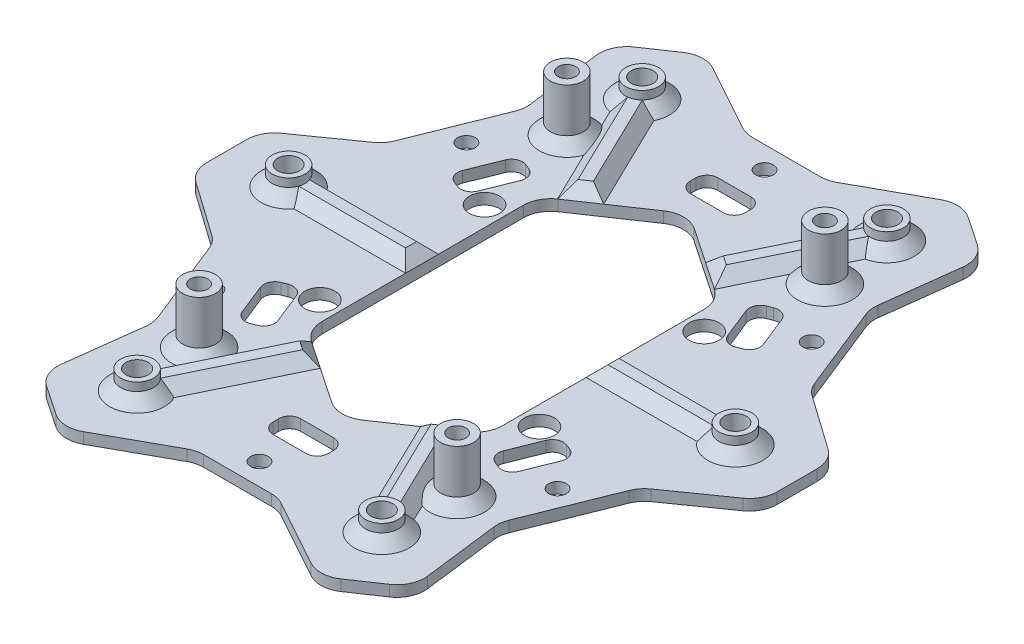
from build123d import *

# Parameters (mm, degrees)
BOSS_EXTRUDE1_DEPTH     = 2
BOSS_EXTRUDE2_DEPTH     = 2
MIRROR2_COPY_1_DEPTH    = 2
SKETCH2_R               = 3
SKETCH2_R_2             = 2
BOSS_EXTRUDE4_DEPTH     = 3.5
BOSS_EXTRUDE3_DEPTH     = 2
FILLET1_R               = 5
SKETCH13_R              = 1.6
CUT_EXTRUDE7_DEPTH      = 10
CUT_EXTRUDE8_DEPTH      = 78.908421133
CUT_EXTRUDE8_DEPTH_BACK = 78.908421133
SKETCH14_R              = 2
CHAMFER1_SIZE           = 2
SKETCH15_W              = 10
SKETCH15_H              = 5
CUT_EXTRUDE9_DEPTH      = 79.023855861
FILLET2_R               = 2
FILLET3_R               = 5
SKETCH16_R              = 3
SKETCH16_R_2            = 1.6
BOSS_EXTRUDE5_DEPTH     = 10
CUT_EXTRUDE10_START     = -10
SKETCH17_R              = 1.6
CUT_EXTRUDE10_DEPTH     = 10
CHAMFER2_SIZE           = 2
SKETCH18_W              = 20.216263692
SKETCH18_H              = 2
SKETCH18_W_2            = 20.016263692
BOSS_EXTRUDE6_DEPTH     = 2
CHAMFER3_SIZE           = 2
SKETCH19_R              = 2.75
CUT_EXTRUDE11_DEPTH     = 79.469561509


with BuildPart() as part:
    # Sketch1 → Boss-Extrude1 (new body)
    with BuildSketch(Plane(origin=(0, 0, 0), x_dir=(1, 0, 0), z_dir=(0, 1, 0))):
        Polygon((-25, 50), (25, 50), (45, 0), (25, -50), (-25, -50), (-45, 0), align=None)
    extrude(amount=BOSS_EXTRUDE1_DEPTH)

    # Sketch4 → Boss-Extrude2 (add)
    with BuildSketch(Plane(origin=(0, 2, 0), x_dir=(1, 0, 0), z_dir=(0, 1, 0))):
        Polygon((-33.774362449, 51.811826285), (-31.51705081, 33.707372975), (-25, 50), (-7.452303666, 50), (-23.423522069, 58.819686401), align=None)
    boss_extrude2 = extrude(amount=-BOSS_EXTRUDE2_DEPTH)

    # Mirror1: Boss-Extrude2 across plane
    add(boss_extrude2.mirror(Plane(origin=(0, 0, 0), x_dir=(0, 0, 1), z_dir=(1, 0, 0))))

    # Mirror2: Boss-Extrude2 across plane
    add(boss_extrude2.mirror(Plane.XY))

    # Mirror2 copy 1 sketch → Mirror2 copy 1 (add)
    with BuildSketch(Plane(origin=(0, 2, 0), x_dir=(-1, 0, 0), z_dir=(0, 1, 0))):
        Polygon((-33.774362449, 51.811826285), (-31.51705081, 33.707372975), (-25, 50), (-7.452303666, 50), (-23.423522069, 58.819686401), align=None)
    extrude(amount=-MIRROR2_COPY_1_DEPTH)

    # Sketch2 → Boss-Extrude4 (add)
    # profile 1 of 6: a face of its own
    with BuildSketch(Plane(origin=(0, 2, 0), x_dir=(1, 0, 0), z_dir=(0, 1, 0))):
        with Locations(Location((22.291868154, -46, 0), (0, 0, 90))):
            Circle(SKETCH2_R)
        with Locations(Location((22.291868154, -46, 0), (0, 0, 270))):
            Circle(SKETCH2_R_2, mode=Mode.SUBTRACT)
    # profile 2 of 6: a face of its own
    with BuildSketch(Plane(origin=(0, 2, 0), x_dir=(1, 0, 0), z_dir=(0, 1, 0))):
        with Locations(Location((-22.291868154, -46, 0), (0, 0, 90))):
            Circle(SKETCH2_R)
        with Locations(Location((-22.291868154, -46, 0), (0, 0, 270))):
            Circle(SKETCH2_R_2, mode=Mode.SUBTRACT)
    # profile 3 of 6: a face of its own
    with BuildSketch(Plane(origin=(0, 2, 0), x_dir=(1, 0, 0), z_dir=(0, 1, 0))):
        with Locations(Location((-40.691868154, 0, 0), (0, 0, 90))):
            Circle(SKETCH2_R)
        with Locations(Location((-40.691868154, 0, 0), (0, 0, 270))):
            Circle(SKETCH2_R_2, mode=Mode.SUBTRACT)
    # profile 4 of 6: a face of its own
    with BuildSketch(Plane(origin=(0, 2, 0), x_dir=(1, 0, 0), z_dir=(0, 1, 0))):
        with Locations(Location((40.691868154, 0, 0), (0, 0, 90))):
            Circle(SKETCH2_R)
        with Locations(Location((40.691868154, 0, 0), (0, 0, 270))):
            Circle(SKETCH2_R_2, mode=Mode.SUBTRACT)
    # profile 5 of 6: a face of its own
    with BuildSketch(Plane(origin=(0, 2, 0), x_dir=(1, 0, 0), z_dir=(0, 1, 0))):
        with Locations(Location((22.291868154, 46, 0), (0, 0, 90))):
            Circle(SKETCH2_R)
        with Locations(Location((22.291868154, 46, 0), (0, 0, 270))):
            Circle(SKETCH2_R_2, mode=Mode.SUBTRACT)
    # profile 6 of 6: a face of its own
    with BuildSketch(Plane(origin=(0, 2, 0), x_dir=(1, 0, 0), z_dir=(0, 1, 0))):
        with Locations(Location((-22.291868154, 46, 0), (0, 0, 90))):
            Circle(SKETCH2_R)
        with Locations(Location((-22.291868154, 46, 0), (0, 0, 270))):
            Circle(SKETCH2_R_2, mode=Mode.SUBTRACT)
    extrude(amount=BOSS_EXTRUDE4_DEPTH)

    # Sketch7 → Boss-Extrude3 (add)
    with BuildSketch(Plane(origin=(0, 2, 0), x_dir=(1, 0, 0), z_dir=(0, 1, 0))):
        Polygon((-38.786093236, -15.534766909), (-42.5, -6.25), (-45, 0), (-42.5, 6.25), (-38.786093236, 15.534766909), (-51.941868154, 6.25), (-51.941868154, -6.25), align=None)
    boss_extrude3 = extrude(amount=-BOSS_EXTRUDE3_DEPTH)

    # Mirror3: Boss-Extrude3 across plane
    add(boss_extrude3.mirror(Plane(origin=(0, 0, 0), x_dir=(0, 0, 1), z_dir=(1, 0, 0))))

    # Fillet1
    fillet1_edges = [part.edges().sort_by_distance(p)[0] for p in [
        (-51.941868154, 1, 6.25),
        (-38.786093236, 1, 15.534766909),
        (-38.786093236, 1, -15.534766909),
        (-51.941868154, 1, -6.25),
        (38.786093236, 1, 15.534766909),
        (51.941868154, 1, 6.25),
        (51.941868154, 1, -6.25),
        (38.786093236, 1, -15.534766909),
        (-31.51705081, 1, -33.707372975),
        (-7.452303666, 1, -50),
        (-23.423522069, 1, -58.819686401),
        (-33.774362449, 1, -51.811826285),
        (23.423522069, 1, -58.819686401),
        (33.774362449, 1, -51.811826285),
        (31.51705081, 1, -33.707372975),
        (7.452303666, 1, -50),
        (-23.423522069, 1, 58.819686401),
        (-33.774362449, 1, 51.811826285),
        (-31.51705081, 1, 33.707372975),
        (-7.452303666, 1, 50),
        (31.51705081, 1, 33.707372975),
        (7.452303666, 1, 50),
        (23.423522069, 1, 58.819686401),
        (33.774362449, 1, 51.811826285),
    ]]
    fillet(fillet1_edges, radius=FILLET1_R)

    # Sketch13 → Cut-Extrude7 (cut)
    with BuildSketch(Plane(origin=(0, 2, 0), x_dir=(1, 0, 0), z_dir=(0, 1, 0))):
        with Locations(Location((-31.43766526, 23.135507236, 0), (0, 0, 270))):
            Circle(SKETCH13_R)
        with Locations(Location((-31.43766526, -23.135507236, 0), (0, 0, 270))):
            Circle(SKETCH13_R)
        with Locations(Location((0, 46, 0), (0, 0, 270))):
            Circle(SKETCH13_R)
        with Locations(Location((31.43766526, 23.135507236, 0), (0, 0, 270))):
            Circle(SKETCH13_R)
        with Locations(Location((0, -46, 0), (0, 0, 270))):
            Circle(SKETCH13_R)
        with Locations(Location((31.43766526, -23.135507236, 0), (0, 0, 270))):
            Circle(SKETCH13_R)
    extrude(amount=-CUT_EXTRUDE7_DEPTH, mode=Mode.SUBTRACT)

    # Sketch14 → Cut-Extrude8 (cut, two sides: drawn at the far end of the back side and taken through both)
    with BuildSketch(Plane(origin=(0, 2, 0), x_dir=(1, 0, 0), z_dir=(0, 1, 0)).offset(-CUT_EXTRUDE8_DEPTH_BACK)):
        with Locations(Location((22.291868154, -46, 0), (0, 0, 270))):
            Circle(SKETCH14_R)
        with Locations(Location((-22.291868154, -46, 0), (0, 0, 270))):
            Circle(SKETCH14_R)
        with Locations(Location((-40.691868154, 0, 0), (0, 0, 270))):
            Circle(SKETCH14_R)
        with Locations(Location((40.691868154, 0, 0), (0, 0, 270))):
            Circle(SKETCH14_R)
        with Locations(Location((22.291868154, 46, 0), (0, 0, 270))):
            Circle(SKETCH14_R)
        with Locations(Location((-22.291868154, 46, 0), (0, 0, 270))):
            Circle(SKETCH14_R)
    extrude(amount=CUT_EXTRUDE8_DEPTH + CUT_EXTRUDE8_DEPTH_BACK, mode=Mode.SUBTRACT)

    # Chamfer1
    chamfer1_edges = [part.edges().sort_by_distance(p)[0] for p in [
        (22.291868154, 2, -43),
        (-22.291868154, 2, -43),
        (22.291868154, 2, 49),
        (-22.291868154, 2, 49),
        (-40.691868154, 2, 3),
        (40.691868154, 2, 3),
    ]]
    chamfer(chamfer1_edges, length=CHAMFER1_SIZE)

    # Sketch15 → Cut-Extrude9 (cut, through all)
    with BuildSketch(Plane.XZ):
        Polygon((16.491868154, -21.1024889), (16.491868154, 20.8524889), (0.05, 31.984175588), (-16.391868154, 20.8524889), (-16.391868154, -21.1024889), (0.05, -32.234175588), align=None)
        Polygon((23.510040742, -14.682453293), (28.152424196, -16.539406675), (24.438517433, -25.824173584), (19.796133978, -23.967220202), align=None)
        with Locations((0, -38)):
            Rectangle(SKETCH15_W, SKETCH15_H)
        with Locations((0, 38)):
            Rectangle(SKETCH15_W, SKETCH15_H)
        Polygon((-19.796133978, -23.967220202), (-24.438517433, -25.824173584), (-28.152424196, -16.539406675), (-23.510040742, -14.682453293), align=None)
        Polygon((-23.510040742, 14.682453293), (-28.152424196, 16.539406675), (-24.438517433, 25.824173584), (-19.796133978, 23.967220202), align=None)
        Polygon((19.796133978, 23.967220202), (24.438517433, 25.824173584), (28.152424196, 16.539406675), (23.510040742, 14.682453293), align=None)
    extrude(amount=-CUT_EXTRUDE9_DEPTH, mode=Mode.SUBTRACT)

    # Fillet2
    fillet2_edges = [part.edges().sort_by_distance(p)[0] for p in [
        (-23.510040742, 1, -14.682453293),
        (-19.796133978, 1, -23.967220202),
        (-24.438517433, 1, -25.824173584),
        (-28.152424196, 1, -16.539406675),
        (19.796133978, 1, -23.967220202),
        (23.510040742, 1, -14.682453293),
        (28.152424196, 1, -16.539406675),
        (24.438517433, 1, -25.824173584),
        (-5, 1, -40.5),
        (-5, 1, -35.5),
        (5, 1, -35.5),
        (5, 1, -40.5),
        (-5, 1, 35.5),
        (-5, 1, 40.5),
        (5, 1, 40.5),
        (5, 1, 35.5),
        (-19.796133978, 1, 23.967220202),
        (-23.510040742, 1, 14.682453293),
        (-28.152424196, 1, 16.539406675),
        (-24.438517433, 1, 25.824173584),
        (23.510040742, 1, 14.682453293),
        (19.796133978, 1, 23.967220202),
        (24.438517433, 1, 25.824173584),
        (28.152424196, 1, 16.539406675),
    ]]
    fillet(fillet2_edges, radius=FILLET2_R)

    # Fillet3
    fillet3_edges = [part.edges().sort_by_distance(p)[0] for p in [
        (16.491868154, 1, -21.1024889),
        (0.05, 1, -32.234175588),
        (-16.391868154, 1, -21.1024889),
        (-16.391868154, 1, 20.8524889),
        (0.05, 1, 31.984175588),
        (16.491868154, 1, 20.8524889),
    ]]
    fillet(fillet3_edges, radius=FILLET3_R)

    # Sketch16 → Boss-Extrude5 (add)
    # profile 1 of 4: a face of its own
    with BuildSketch(Plane(origin=(0, 2, 0), x_dir=(1, 0, 0), z_dir=(0, 1, 0))):
        with Locations(Location((-23.5, -33.5, 0), (0, 0, 90))):
            Circle(SKETCH16_R)
        with Locations(Location((-23.5, -33.5, 0), (0, 0, 270))):
            Circle(SKETCH16_R_2, mode=Mode.SUBTRACT)
    # profile 2 of 4: a face of its own
    with BuildSketch(Plane(origin=(0, 2, 0), x_dir=(1, 0, 0), z_dir=(0, 1, 0))):
        with Locations(Location((-23.5, 33.5, 0), (0, 0, 90))):
            Circle(SKETCH16_R)
        with Locations(Location((-23.5, 33.5, 0), (0, 0, 270))):
            Circle(SKETCH16_R_2, mode=Mode.SUBTRACT)
    # profile 3 of 4: a face of its own
    with BuildSketch(Plane(origin=(0, 2, 0), x_dir=(1, 0, 0), z_dir=(0, 1, 0))):
        with Locations(Location((23.5, 33.5, 0), (0, 0, 90))):
            Circle(SKETCH16_R)
        with Locations(Location((23.5, 33.5, 0), (0, 0, 270))):
            Circle(SKETCH16_R_2, mode=Mode.SUBTRACT)
    # profile 4 of 4: a face of its own
    with BuildSketch(Plane(origin=(0, 2, 0), x_dir=(1, 0, 0), z_dir=(0, 1, 0))):
        with Locations(Location((23.5, -33.5, 0), (0, 0, 90))):
            Circle(SKETCH16_R)
        with Locations(Location((23.5, -33.5, 0), (0, 0, 270))):
            Circle(SKETCH16_R_2, mode=Mode.SUBTRACT)
    extrude(amount=BOSS_EXTRUDE5_DEPTH)

    # Sketch17 → Cut-Extrude10 (cut)
    with BuildSketch(Plane(origin=(0, 2, 0), x_dir=(1, 0, 0), z_dir=(0, 1, 0)).offset(CUT_EXTRUDE10_START)):
        with Locations(Location((-23.5, -33.5, 0), (0, 0, 90))):
            Circle(SKETCH17_R)
        with Locations(Location((-23.5, 33.5, 0), (0, 0, 90))):
            Circle(SKETCH17_R)
        with Locations(Location((23.5, 33.5, 0), (0, 0, 90))):
            Circle(SKETCH17_R)
        with Locations(Location((23.5, -33.5, 0), (0, 0, 90))):
            Circle(SKETCH17_R)
    extrude(amount=CUT_EXTRUDE10_DEPTH, mode=Mode.SUBTRACT)

    # Chamfer2
    chamfer2_edges = [part.edges().sort_by_distance(p)[0] for p in [
        (-23.5, 2, 36.5),
        (-23.5, 2, -30.5),
        (23.5, 2, -30.5),
        (23.5, 2, 36.5),
    ]]
    chamfer(chamfer2_edges, length=CHAMFER2_SIZE)

    # Sketch18 → Boss-Extrude6 (add)
    with BuildSketch(Plane(origin=(0, 2, 0), x_dir=(1, 0, 0), z_dir=(0, 1, 0))):
        Polygon((22.159613697, -43.434019165), (14.091824838, -26.785872633), (13.401014009, -25.360361863), (11.727586205, -26.493327645), (12.292025213, -27.658066024), (20.359814072, -44.306212555), align=None)
        with Locations((-28.5, 0)):
            Rectangle(SKETCH18_W, SKETCH18_H)
        with Locations((28.5, 0)):
            Rectangle(SKETCH18_W_2, SKETCH18_H)
        Polygon((-22.159613697, -43.434019165), (-14.091824838, -26.785872633), (-13.376309877, -25.309384078), (-11.702882073, -26.44234986), (-12.292025213, -27.658066024), (-20.359814072, -44.306212555), align=None)
        Polygon((-20.519774952, 44.63629707), (-11.794104115, 26.630589531), (-13.467531919, 25.497623749), (-22.319574577, 43.76410368), align=None)
        Polygon((22.13034796, 43.37362836), (14.121090574, 26.846263439), (13.492236051, 25.548601534), (11.818808247, 26.681567316), (12.321290949, 27.718456829), (20.330548335, 44.24582175), align=None)
    extrude(amount=BOSS_EXTRUDE6_DEPTH)

    # Chamfer3
    # the kernel refuses this chamfer: 2 mm, written as the material it adds along each edge
    with BuildSketch(Plane(origin=(23.298344108, 2, 45.783826662), x_dir=(0.8998998125128265, 0, -0.4360966950567039), z_dir=(-0.43609669505670384, 0, -0.8998998125128265))) as chamfer3_piece_1_section:
        Polygon((CHAMFER3_SIZE, 0), (0, -CHAMFER3_SIZE), (0, 0), align=None)
    chamfer3_piece_1 = extrude(amount=27.838631065, mode=Mode.PRIVATE)
    chamfer3_piece_1 = chamfer3_piece_1 - Plane(origin=(22.291868154, 2, 46), x_dir=(0, 0, -1), z_dir=(0, -1, 0)) * Cylinder(3, 64, mode=Mode.PRIVATE)
    chamfer3_piece_1 = split(chamfer3_piece_1, bisect_by=Plane(origin=(10.706211611, 2, 27.18483191), z_dir=(0.5606288093051826, 0, 0.8280672304692738)), keep=Keep.TOP, mode=Mode.PRIVATE)
    add(chamfer3_piece_1)
    with BuildSketch(Plane(origin=(9.484581301, 2, 21.864813567), x_dir=(-0.8998998125128264, 0, 0.436096695056704), z_dir=(0.43609669505670406, 0, 0.8998998125128265))) as chamfer3_piece_2_section:
        Polygon((CHAMFER3_SIZE, 0), (0, -CHAMFER3_SIZE), (0, 0), align=None)
    chamfer3_piece_2 = extrude(amount=27.548851705, mode=Mode.PRIVATE)
    chamfer3_piece_2 = chamfer3_piece_2 - Plane(origin=(22.291868154, 2, 46), x_dir=(0, 0, -1), z_dir=(0, -1, 0)) * Cylinder(3, 64, mode=Mode.PRIVATE)
    chamfer3_piece_2 = split(chamfer3_piece_2, bisect_by=Plane(origin=(12.338301916, 2, 26.079852978), z_dir=(0.5606288093051826, 0, 0.8280672304692738)), keep=Keep.TOP, mode=Mode.PRIVATE)
    add(chamfer3_piece_2)
    with BuildSketch(Plane(origin=(-11.224527015, 2, -20.869109672), x_dir=(-0.8998998125128265, 0, 0.43609669505670395), z_dir=(-0.436096695056704, 0, -0.8998998125128265))) as chamfer3_piece_3_section:
        Polygon((CHAMFER3_SIZE, 0), (0, CHAMFER3_SIZE), (0, 0), align=None)
    chamfer3_piece_3 = extrude(amount=27.686100879, mode=Mode.PRIVATE)
    chamfer3_piece_3 = chamfer3_piece_3 - Plane(origin=(-22.291868154, 2, -46), x_dir=(0, 0, -1), z_dir=(0, -1, 0)) * Cylinder(3, 64, mode=Mode.PRIVATE)
    chamfer3_piece_3 = split(chamfer3_piece_3, bisect_by=Plane(origin=(-14.07824763, 2, -25.084149083), z_dir=(-0.5606288093051838, 0, -0.828067230469273)), keep=Keep.TOP, mode=Mode.PRIVATE)
    add(chamfer3_piece_3)
    with BuildSketch(Plane(origin=(-21.498544483, 2, -46.656020052), x_dir=(0.8998998125128265, 0, -0.4360966950567039), z_dir=(0.43609669505670395, 0, 0.8998998125128265))) as chamfer3_piece_4_section:
        Polygon((CHAMFER3_SIZE, 0), (0, CHAMFER3_SIZE), (0, 0), align=None)
    chamfer3_piece_4 = extrude(amount=27.396321519, mode=Mode.PRIVATE)
    chamfer3_piece_4 = chamfer3_piece_4 - Plane(origin=(-22.291868154, 2, -46), x_dir=(0, 0, -1), z_dir=(0, -1, 0)) * Cylinder(3, 63, mode=Mode.PRIVATE)
    chamfer3_piece_4 = split(chamfer3_piece_4, bisect_by=Plane(origin=(-9.151820903, 2, -28.419502359), z_dir=(-0.5606288093051838, 0, -0.828067230469273)), keep=Keep.TOP, mode=Mode.PRIVATE)
    add(chamfer3_piece_4)
    with BuildSketch(Plane(origin=(-7.535051296, 2, -29.514108674), x_dir=(0.5606288093051838, 0, 0.8280672304692729), z_dir=(-0.828067230469273, 0, 0.5606288093051838))) as chamfer3_piece_5_section:
        Polygon((CHAMFER3_SIZE, 0), (0, CHAMFER3_SIZE), (0, 0), align=None)
    chamfer3_piece_5 = extrude(amount=12.307615936, mode=Mode.PRIVATE)
    chamfer3_piece_5 = split(chamfer3_piece_5, bisect_by=Plane(origin=(-13.915533547, 2, -26.42208978), z_dir=(0.8998998125128265, 0, -0.436096695056704)), keep=Keep.TOP, mode=Mode.PRIVATE)
    chamfer3_piece_5 = split(chamfer3_piece_5, bisect_by=Plane(origin=(-12.115733922, 2, -27.294283171), z_dir=(-0.8998998125128265, 0, 0.43609669505670395)), keep=Keep.TOP, mode=Mode.PRIVATE)
    add(chamfer3_piece_5)
    with BuildSketch(Plane(origin=(21.498544483, 2, -46.656020052), x_dir=(-0.899899812512827, 0, -0.4360966950567028), z_dir=(-0.43609669505670273, 0, 0.899899812512827))) as chamfer3_piece_6_section:
        Polygon((CHAMFER3_SIZE, 0), (0, -CHAMFER3_SIZE), (0, 0), align=None)
    chamfer3_piece_6 = extrude(amount=27.33967323, mode=Mode.PRIVATE)
    chamfer3_piece_6 = chamfer3_piece_6 - Plane(origin=(22.291868154, 2, -46), x_dir=(0, 0, -1), z_dir=(0, -1, 0)) * Cylinder(3, 63, mode=Mode.PRIVATE)
    chamfer3_piece_6 = split(chamfer3_piece_6, bisect_by=Plane(origin=(9.183251369, 2, -28.465926194), z_dir=(0.5606288093051821, 0, -0.828067230469274)), keep=Keep.TOP, mode=Mode.PRIVATE)
    add(chamfer3_piece_6)
    with BuildSketch(Plane(origin=(11.249231147, 2, -20.920087456), x_dir=(0.8998998125128266, 0, 0.4360966950567037), z_dir=(0.4360966950567037, 0, -0.8998998125128266))) as chamfer3_piece_7_section:
        Polygon((CHAMFER3_SIZE, 0), (0, -CHAMFER3_SIZE), (0, 0), align=None)
    chamfer3_piece_7 = extrude(amount=27.62945259, mode=Mode.PRIVATE)
    chamfer3_piece_7 = chamfer3_piece_7 - Plane(origin=(22.291868154, 2, -46), x_dir=(0, 0, -1), z_dir=(0, -1, 0)) * Cylinder(3, 64, mode=Mode.PRIVATE)
    chamfer3_piece_7 = split(chamfer3_piece_7, bisect_by=Plane(origin=(14.102951762, 2, -25.135126867), z_dir=(0.5606288093051821, 0, -0.828067230469274)), keep=Keep.TOP, mode=Mode.PRIVATE)
    add(chamfer3_piece_7)
    with BuildSketch(Plane(origin=(40.936254645, 2, -1), x_dir=(0, 0, -1), z_dir=(-1, 0, 0))) as chamfer3_piece_8_section:
        Polygon((CHAMFER3_SIZE, 0), (0, -CHAMFER3_SIZE), (0, 0), align=None)
    chamfer3_piece_8 = extrude(amount=22.44438649, mode=Mode.PRIVATE)
    chamfer3_piece_8 = chamfer3_piece_8 - Plane(origin=(40.691868154, 2, 0), x_dir=(0, 0, -1), z_dir=(0, -1, 0)) * Cylinder(3, 53, mode=Mode.PRIVATE)
    add(chamfer3_piece_8)
    with BuildSketch(Plane(origin=(18.491868154, 2, -1), x_dir=(-1, 0, 0), z_dir=(0, 0, 1)), Plane(origin=(-18.391868154, 2, 1), x_dir=(1, 0, 0), z_dir=(0, 0, -1))) as chamfer3_piece_9:
        Polygon((CHAMFER3_SIZE, 0), (0, -CHAMFER3_SIZE), (0, 0), align=None)
    extrude(amount=2)
    with BuildSketch(Plane(origin=(18.491868154, 2, 1), x_dir=(0, 0, 1), z_dir=(1, 0, 0))) as chamfer3_piece_10_section:
        Polygon((CHAMFER3_SIZE, 0), (0, -CHAMFER3_SIZE), (0, 0), align=None)
    chamfer3_piece_10 = extrude(amount=22.44438649, mode=Mode.PRIVATE)
    chamfer3_piece_10 = chamfer3_piece_10 - Plane(origin=(40.691868154, 2, 0), x_dir=(0, 0, -1), z_dir=(0, -1, 0)) * Cylinder(3, 53, mode=Mode.PRIVATE)
    add(chamfer3_piece_10)
    with BuildSketch(Plane(origin=(-40.936254645, 2, 1), x_dir=(0, 0, 1), z_dir=(1, 0, 0))) as chamfer3_piece_11_section:
        Polygon((CHAMFER3_SIZE, 0), (0, -CHAMFER3_SIZE), (0, 0), align=None)
    chamfer3_piece_11 = extrude(amount=22.54438649, mode=Mode.PRIVATE)
    chamfer3_piece_11 = chamfer3_piece_11 - Plane(origin=(-40.691868154, 2, 0), x_dir=(0, 0, -1), z_dir=(0, -1, 0)) * Cylinder(3, 54, mode=Mode.PRIVATE)
    add(chamfer3_piece_11)
    with BuildSketch(Plane(origin=(-18.391868154, 2, -1), x_dir=(0, 0, -1), z_dir=(-1, 0, 0))) as chamfer3_piece_12_section:
        Polygon((CHAMFER3_SIZE, 0), (0, -CHAMFER3_SIZE), (0, 0), align=None)
    chamfer3_piece_12 = extrude(amount=22.54438649, mode=Mode.PRIVATE)
    chamfer3_piece_12 = chamfer3_piece_12 - Plane(origin=(-40.691868154, 2, 0), x_dir=(0, 0, -1), z_dir=(0, -1, 0)) * Cylinder(3, 54, mode=Mode.PRIVATE)
    add(chamfer3_piece_12)
    with BuildSketch(Plane(origin=(-21.498544483, 2, 46.656020052), x_dir=(0.8998998125128265, 0, 0.43609669505670384), z_dir=(0.43609669505670384, 0, -0.8998998125128266))) as chamfer3_piece_13_section:
        Polygon((CHAMFER3_SIZE, 0), (0, -CHAMFER3_SIZE), (0, 0), align=None)
    chamfer3_piece_13 = extrude(amount=27.605499994, mode=Mode.PRIVATE)
    chamfer3_piece_13 = chamfer3_piece_13 - Plane(origin=(-22.291868154, 2, 46), x_dir=(0, 0, -1), z_dir=(0, -1, 0)) * Cylinder(3, 64, mode=Mode.PRIVATE)
    chamfer3_piece_13 = split(chamfer3_piece_13, bisect_by=Plane(origin=(-9.035761316, 2, 28.248078524), z_dir=(-0.5606288093051821, 0, 0.828067230469274)), keep=Keep.TOP, mode=Mode.PRIVATE)
    add(chamfer3_piece_13)
    with BuildSketch(Plane(origin=(-11.133304973, 2, 20.680870001), x_dir=(-0.8998998125128266, 0, -0.4360966950567037), z_dir=(-0.4360966950567037, 0, 0.8998998125128266))) as chamfer3_piece_14_section:
        Polygon((CHAMFER3_SIZE, 0), (0, -CHAMFER3_SIZE), (0, 0), align=None)
    chamfer3_piece_14 = extrude(amount=27.895279354, mode=Mode.PRIVATE)
    chamfer3_piece_14 = chamfer3_piece_14 - Plane(origin=(-22.291868154, 2, 46), x_dir=(0, 0, -1), z_dir=(0, -1, 0)) * Cylinder(3, 64, mode=Mode.PRIVATE)
    chamfer3_piece_14 = split(chamfer3_piece_14, bisect_by=Plane(origin=(-13.987025588, 2, 24.895909412), z_dir=(-0.5606288093051821, 0, 0.828067230469274)), keep=Keep.TOP, mode=Mode.PRIVATE)
    add(chamfer3_piece_14)
    with BuildSketch(Plane(origin=(17.75128887, 2, -22.665082391), x_dir=(-0.5606288093051821, 0, 0.828067230469274), z_dir=(-0.828067230469274, 0, -0.5606288093051821))) as chamfer3_piece_15_section:
        Polygon((CHAMFER3_SIZE, 0), (0, CHAMFER3_SIZE), (0, 0), align=None)
    chamfer3_piece_15 = extrude(amount=12.307615936, mode=Mode.PRIVATE)
    chamfer3_piece_15 = split(chamfer3_piece_15, bisect_by=Plane(origin=(11.370806619, 2, -25.757101284), z_dir=(0.8998998125128278, 0, 0.43609669505670123)), keep=Keep.TOP, mode=Mode.PRIVATE)
    chamfer3_piece_15 = split(chamfer3_piece_15, bisect_by=Plane(origin=(13.170606244, 2, -24.884907894), z_dir=(-0.8998998125128269, 0, -0.4360966950567029)), keep=Keep.TOP, mode=Mode.PRIVATE)
    add(chamfer3_piece_15)
    with BuildSketch(Plane(origin=(17.660066828, 2, 22.47684272), x_dir=(-0.5606288093051826, 0, -0.8280672304692737), z_dir=(-0.8280672304692738, 0, 0.5606288093051826))) as chamfer3_piece_16_section:
        Polygon((CHAMFER3_SIZE, 0), (0, -CHAMFER3_SIZE), (0, 0), align=None)
    chamfer3_piece_16 = extrude(amount=12.307615936, mode=Mode.PRIVATE)
    chamfer3_piece_16 = split(chamfer3_piece_16, bisect_by=Plane(origin=(13.079384202, 2, 24.696668223), z_dir=(-0.8998998125128287, 0, 0.43609669505669946)), keep=Keep.TOP, mode=Mode.PRIVATE)
    chamfer3_piece_16 = split(chamfer3_piece_16, bisect_by=Plane(origin=(11.279584577, 2, 25.568861613), z_dir=(0.8998998125127963, 0, -0.43609669505676624)), keep=Keep.TOP, mode=Mode.PRIVATE)
    add(chamfer3_piece_16)
    with BuildSketch(Plane(origin=(-17.635362696, 2, 22.425864935), x_dir=(0.5606288093051821, 0, -0.828067230469274), z_dir=(0.828067230469274, 0, 0.5606288093051821))) as chamfer3_piece_17_section:
        Polygon((CHAMFER3_SIZE, 0), (0, CHAMFER3_SIZE), (0, 0), align=None)
    chamfer3_piece_17 = extrude(amount=12.307615936, mode=Mode.PRIVATE)
    chamfer3_piece_17 = split(chamfer3_piece_17, bisect_by=Plane(origin=(-11.254880445, 2, 25.517883829), z_dir=(-0.8998998125128264, 0, -0.4360966950567041)), keep=Keep.TOP, mode=Mode.PRIVATE)
    chamfer3_piece_17 = split(chamfer3_piece_17, bisect_by=Plane(origin=(-13.05468007, 2, 24.645690439), z_dir=(0.8998998125128266, 0, 0.4360966950567036)), keep=Keep.TOP, mode=Mode.PRIVATE)
    add(chamfer3_piece_17)
    with BuildSketch(Plane(origin=(23.298344108, 2, 45.783826662), x_dir=(0.8998998125128265, 0, -0.4360966950567039), z_dir=(-0.43609669505670384, 0, -0.8998998125128265))) as chamfer3_piece_18a_section:
        Polygon((CHAMFER3_SIZE, 0), (0, -CHAMFER3_SIZE), (0, 0), align=None)
    chamfer3_piece_18a = extrude(amount=27.838631065, mode=Mode.PRIVATE)
    chamfer3_piece_18a = split(chamfer3_piece_18a, bisect_by=Plane(origin=(9.584953993, 2, 25.52869745), z_dir=(0.5606288093051828, 0, 0.8280672304692737)), keep=Keep.TOP, mode=Mode.PRIVATE)
    chamfer3_piece_18a = split(chamfer3_piece_18a, bisect_by=Plane(origin=(10.706211611, 2, 27.18483191), z_dir=(-0.5606288093051826, 0, -0.8280672304692738)), keep=Keep.TOP, mode=Mode.PRIVATE)
    with BuildSketch(Plane(origin=(17.660066828, 2, 22.47684272), x_dir=(-0.5606288093051826, 0, -0.8280672304692737), z_dir=(-0.8280672304692738, 0, 0.5606288093051826))) as chamfer3_piece_18b_section:
        Polygon((CHAMFER3_SIZE, 0), (0, -CHAMFER3_SIZE), (0, 0), align=None)
    chamfer3_piece_18b = extrude(amount=12.307615936, mode=Mode.PRIVATE)
    chamfer3_piece_18b = split(chamfer3_piece_18b, bisect_by=Plane(origin=(13.079384202, 2, 24.696668223), z_dir=(0.8998998125128287, 0, -0.43609669505669946)), keep=Keep.TOP, mode=Mode.PRIVATE)
    chamfer3_piece_18 = chamfer3_piece_18a & chamfer3_piece_18b
    add(chamfer3_piece_18)
    with BuildSketch(Plane(origin=(9.484581301, 2, 21.864813567), x_dir=(-0.8998998125128264, 0, 0.436096695056704), z_dir=(0.43609669505670406, 0, 0.8998998125128265))) as chamfer3_piece_19a_section:
        Polygon((CHAMFER3_SIZE, 0), (0, -CHAMFER3_SIZE), (0, 0), align=None)
    chamfer3_piece_19a = extrude(amount=27.548851705, mode=Mode.PRIVATE)
    chamfer3_piece_19a = split(chamfer3_piece_19a, bisect_by=Plane(origin=(11.217044297, 2, 24.423718517), z_dir=(0.5606288093051828, 0, 0.8280672304692737)), keep=Keep.TOP, mode=Mode.PRIVATE)
    chamfer3_piece_19a = split(chamfer3_piece_19a, bisect_by=Plane(origin=(12.338301916, 2, 26.079852978), z_dir=(-0.5606288093051826, 0, -0.8280672304692738)), keep=Keep.TOP, mode=Mode.PRIVATE)
    with BuildSketch(Plane(origin=(17.660066828, 2, 22.47684272), x_dir=(-0.5606288093051826, 0, -0.8280672304692737), z_dir=(-0.8280672304692738, 0, 0.5606288093051826))) as chamfer3_piece_19b_section:
        Polygon((CHAMFER3_SIZE, 0), (0, -CHAMFER3_SIZE), (0, 0), align=None)
    chamfer3_piece_19b = extrude(amount=12.307615936, mode=Mode.PRIVATE)
    chamfer3_piece_19b = split(chamfer3_piece_19b, bisect_by=Plane(origin=(11.279584577, 2, 25.568861613), z_dir=(-0.8998998125127963, 0, 0.43609669505676624)), keep=Keep.TOP, mode=Mode.PRIVATE)
    chamfer3_piece_19 = chamfer3_piece_19a & chamfer3_piece_19b
    add(chamfer3_piece_19)
    with BuildSketch(Plane(origin=(-11.224527015, 2, -20.869109672), x_dir=(-0.8998998125128265, 0, 0.43609669505670395), z_dir=(-0.436096695056704, 0, -0.8998998125128265))) as chamfer3_piece_20a_section:
        Polygon((CHAMFER3_SIZE, 0), (0, CHAMFER3_SIZE), (0, 0), align=None)
    chamfer3_piece_20a = extrude(amount=27.686100879, mode=Mode.PRIVATE)
    chamfer3_piece_20a = split(chamfer3_piece_20a, bisect_by=Plane(origin=(-14.07824763, 2, -25.084149083), z_dir=(0.5606288093051838, 0, 0.828067230469273)), keep=Keep.TOP, mode=Mode.PRIVATE)
    chamfer3_piece_20a = split(chamfer3_piece_20a, bisect_by=Plane(origin=(-12.956990012, 2, -23.428014622), z_dir=(-0.5606288093051829, 0, -0.8280672304692736)), keep=Keep.TOP, mode=Mode.PRIVATE)
    with BuildSketch(Plane(origin=(-7.535051296, 2, -29.514108674), x_dir=(0.5606288093051838, 0, 0.8280672304692729), z_dir=(-0.828067230469273, 0, 0.5606288093051838))) as chamfer3_piece_20b_section:
        Polygon((CHAMFER3_SIZE, 0), (0, CHAMFER3_SIZE), (0, 0), align=None)
    chamfer3_piece_20b = extrude(amount=12.307615936, mode=Mode.PRIVATE)
    chamfer3_piece_20b = split(chamfer3_piece_20b, bisect_by=Plane(origin=(-13.915533547, 2, -26.42208978), z_dir=(-0.8998998125128265, 0, 0.436096695056704)), keep=Keep.TOP, mode=Mode.PRIVATE)
    chamfer3_piece_20 = chamfer3_piece_20a & chamfer3_piece_20b
    add(chamfer3_piece_20)
    with BuildSketch(Plane(origin=(-21.498544483, 2, -46.656020052), x_dir=(0.8998998125128265, 0, -0.4360966950567039), z_dir=(0.43609669505670395, 0, 0.8998998125128265))) as chamfer3_piece_21a_section:
        Polygon((CHAMFER3_SIZE, 0), (0, CHAMFER3_SIZE), (0, 0), align=None)
    chamfer3_piece_21a = extrude(amount=27.396321519, mode=Mode.PRIVATE)
    chamfer3_piece_21a = split(chamfer3_piece_21a, bisect_by=Plane(origin=(-9.151820903, 2, -28.419502359), z_dir=(0.5606288093051838, 0, 0.828067230469273)), keep=Keep.TOP, mode=Mode.PRIVATE)
    chamfer3_piece_21a = split(chamfer3_piece_21a, bisect_by=Plane(origin=(-8.030563284, 2, -26.763367898), z_dir=(-0.5606288093051829, 0, -0.8280672304692736)), keep=Keep.TOP, mode=Mode.PRIVATE)
    with BuildSketch(Plane(origin=(-7.535051296, 2, -29.514108674), x_dir=(0.5606288093051838, 0, 0.8280672304692729), z_dir=(-0.828067230469273, 0, 0.5606288093051838))) as chamfer3_piece_21b_section:
        Polygon((CHAMFER3_SIZE, 0), (0, CHAMFER3_SIZE), (0, 0), align=None)
    chamfer3_piece_21b = extrude(amount=12.307615936, mode=Mode.PRIVATE)
    chamfer3_piece_21b = split(chamfer3_piece_21b, bisect_by=Plane(origin=(-12.115733922, 2, -27.294283171), z_dir=(0.8998998125128265, 0, -0.43609669505670395)), keep=Keep.TOP, mode=Mode.PRIVATE)
    chamfer3_piece_21 = chamfer3_piece_21a & chamfer3_piece_21b
    add(chamfer3_piece_21)
    with BuildSketch(Plane(origin=(21.498544483, 2, -46.656020052), x_dir=(-0.899899812512827, 0, -0.4360966950567028), z_dir=(-0.43609669505670273, 0, 0.899899812512827))) as chamfer3_piece_22a_section:
        Polygon((CHAMFER3_SIZE, 0), (0, -CHAMFER3_SIZE), (0, 0), align=None)
    chamfer3_piece_22a = extrude(amount=27.33967323, mode=Mode.PRIVATE)
    chamfer3_piece_22a = split(chamfer3_piece_22a, bisect_by=Plane(origin=(9.183251369, 2, -28.465926194), z_dir=(-0.5606288093051821, 0, 0.828067230469274)), keep=Keep.TOP, mode=Mode.PRIVATE)
    chamfer3_piece_22a = split(chamfer3_piece_22a, bisect_by=Plane(origin=(8.06199375, 2, -26.809791733), z_dir=(0.5606288093051829, 0, -0.8280672304692736)), keep=Keep.TOP, mode=Mode.PRIVATE)
    with BuildSketch(Plane(origin=(17.75128887, 2, -22.665082391), x_dir=(-0.5606288093051821, 0, 0.828067230469274), z_dir=(-0.828067230469274, 0, -0.5606288093051821))) as chamfer3_piece_22b_section:
        Polygon((CHAMFER3_SIZE, 0), (0, CHAMFER3_SIZE), (0, 0), align=None)
    chamfer3_piece_22b = extrude(amount=12.307615936, mode=Mode.PRIVATE)
    chamfer3_piece_22b = split(chamfer3_piece_22b, bisect_by=Plane(origin=(11.370806619, 2, -25.757101284), z_dir=(-0.8998998125128278, 0, -0.43609669505670123)), keep=Keep.TOP, mode=Mode.PRIVATE)
    chamfer3_piece_22 = chamfer3_piece_22a & chamfer3_piece_22b
    add(chamfer3_piece_22)
    with BuildSketch(Plane(origin=(11.249231147, 2, -20.920087456), x_dir=(0.8998998125128266, 0, 0.4360966950567037), z_dir=(0.4360966950567037, 0, -0.8998998125128266))) as chamfer3_piece_23a_section:
        Polygon((CHAMFER3_SIZE, 0), (0, -CHAMFER3_SIZE), (0, 0), align=None)
    chamfer3_piece_23a = extrude(amount=27.62945259, mode=Mode.PRIVATE)
    chamfer3_piece_23a = split(chamfer3_piece_23a, bisect_by=Plane(origin=(14.102951762, 2, -25.135126867), z_dir=(-0.5606288093051821, 0, 0.828067230469274)), keep=Keep.TOP, mode=Mode.PRIVATE)
    chamfer3_piece_23a = split(chamfer3_piece_23a, bisect_by=Plane(origin=(12.981694143, 2, -23.478992406), z_dir=(0.5606288093051829, 0, -0.8280672304692736)), keep=Keep.TOP, mode=Mode.PRIVATE)
    with BuildSketch(Plane(origin=(17.75128887, 2, -22.665082391), x_dir=(-0.5606288093051821, 0, 0.828067230469274), z_dir=(-0.828067230469274, 0, -0.5606288093051821))) as chamfer3_piece_23b_section:
        Polygon((CHAMFER3_SIZE, 0), (0, CHAMFER3_SIZE), (0, 0), align=None)
    chamfer3_piece_23b = extrude(amount=12.307615936, mode=Mode.PRIVATE)
    chamfer3_piece_23b = split(chamfer3_piece_23b, bisect_by=Plane(origin=(13.170606244, 2, -24.884907894), z_dir=(0.8998998125128269, 0, 0.4360966950567029)), keep=Keep.TOP, mode=Mode.PRIVATE)
    chamfer3_piece_23 = chamfer3_piece_23a & chamfer3_piece_23b
    add(chamfer3_piece_23)
    with BuildSketch(Plane(origin=(40.936254645, 2, -1), x_dir=(0, 0, -1), z_dir=(-1, 0, 0))) as chamfer3_piece_24a_section:
        Polygon((CHAMFER3_SIZE, 0), (0, -CHAMFER3_SIZE), (0, 0), align=None)
    chamfer3_piece_24a = extrude(amount=27.587752466, mode=Mode.PRIVATE)
    chamfer3_piece_24a = split(chamfer3_piece_24a, bisect_by=Plane(origin=(16.491868154, 2, -1), z_dir=(1, 0, 0)), keep=Keep.TOP, mode=Mode.PRIVATE)
    chamfer3_piece_24a = split(chamfer3_piece_24a, bisect_by=Plane(origin=(18.491868154, 2, -1), z_dir=(-1, 0, 0)), keep=Keep.TOP, mode=Mode.PRIVATE)
    with BuildSketch(Plane(origin=(18.491868154, 2, -6.143365976), x_dir=(-1, 0, 0), z_dir=(0, 0, 1))) as chamfer3_piece_24b_section:
        Polygon((CHAMFER3_SIZE, 0), (0, -CHAMFER3_SIZE), (0, 0), align=None)
    chamfer3_piece_24b = extrude(amount=7.143365976, mode=Mode.PRIVATE)
    chamfer3_piece_24b = split(chamfer3_piece_24b, bisect_by=Plane(origin=(18.491868154, 2, -1), z_dir=(0, 0, -1)), keep=Keep.TOP, mode=Mode.PRIVATE)
    chamfer3_piece_24 = chamfer3_piece_24a & chamfer3_piece_24b
    add(chamfer3_piece_24)
    with BuildSketch(Plane(origin=(13.348502178, 2, 1), x_dir=(0, 0, 1), z_dir=(1, 0, 0))) as chamfer3_piece_25a_section:
        Polygon((CHAMFER3_SIZE, 0), (0, -CHAMFER3_SIZE), (0, 0), align=None)
    chamfer3_piece_25a = extrude(amount=27.587752466, mode=Mode.PRIVATE)
    chamfer3_piece_25a = split(chamfer3_piece_25a, bisect_by=Plane(origin=(16.491868154, 2, 1), z_dir=(1, 0, 0)), keep=Keep.TOP, mode=Mode.PRIVATE)
    chamfer3_piece_25a = split(chamfer3_piece_25a, bisect_by=Plane(origin=(18.491868154, 2, 1), z_dir=(-1, 0, 0)), keep=Keep.TOP, mode=Mode.PRIVATE)
    with BuildSketch(Plane(origin=(18.491868154, 2, -1), x_dir=(-1, 0, 0), z_dir=(0, 0, 1))) as chamfer3_piece_25b_section:
        Polygon((CHAMFER3_SIZE, 0), (0, -CHAMFER3_SIZE), (0, 0), align=None)
    chamfer3_piece_25b = extrude(amount=7.143365976, mode=Mode.PRIVATE)
    chamfer3_piece_25b = split(chamfer3_piece_25b, bisect_by=Plane(origin=(18.491868154, 2, 1), z_dir=(0, 0, 1)), keep=Keep.TOP, mode=Mode.PRIVATE)
    chamfer3_piece_25 = chamfer3_piece_25a & chamfer3_piece_25b
    add(chamfer3_piece_25)
    with BuildSketch(Plane(origin=(-40.936254645, 2, 1), x_dir=(0, 0, 1), z_dir=(1, 0, 0))) as chamfer3_piece_26a_section:
        Polygon((CHAMFER3_SIZE, 0), (0, -CHAMFER3_SIZE), (0, 0), align=None)
    chamfer3_piece_26a = extrude(amount=27.687752466, mode=Mode.PRIVATE)
    chamfer3_piece_26a = split(chamfer3_piece_26a, bisect_by=Plane(origin=(-16.391868154, 2, 1), z_dir=(-1, 0, 0)), keep=Keep.TOP, mode=Mode.PRIVATE)
    chamfer3_piece_26a = split(chamfer3_piece_26a, bisect_by=Plane(origin=(-18.391868154, 2, 1), z_dir=(1, 0, 0)), keep=Keep.TOP, mode=Mode.PRIVATE)
    with BuildSketch(Plane(origin=(-18.391868154, 2, 6.143365976), x_dir=(1, 0, 0), z_dir=(0, 0, -1))) as chamfer3_piece_26b_section:
        Polygon((CHAMFER3_SIZE, 0), (0, -CHAMFER3_SIZE), (0, 0), align=None)
    chamfer3_piece_26b = extrude(amount=7.143365976, mode=Mode.PRIVATE)
    chamfer3_piece_26b = split(chamfer3_piece_26b, bisect_by=Plane(origin=(-18.391868154, 2, 1), z_dir=(0, 0, 1)), keep=Keep.TOP, mode=Mode.PRIVATE)
    chamfer3_piece_26 = chamfer3_piece_26a & chamfer3_piece_26b
    add(chamfer3_piece_26)
    with BuildSketch(Plane(origin=(-13.248502178, 2, -1), x_dir=(0, 0, -1), z_dir=(-1, 0, 0))) as chamfer3_piece_27a_section:
        Polygon((CHAMFER3_SIZE, 0), (0, -CHAMFER3_SIZE), (0, 0), align=None)
    chamfer3_piece_27a = extrude(amount=27.687752466, mode=Mode.PRIVATE)
    chamfer3_piece_27a = split(chamfer3_piece_27a, bisect_by=Plane(origin=(-16.391868154, 2, -1), z_dir=(-1, 0, 0)), keep=Keep.TOP, mode=Mode.PRIVATE)
    chamfer3_piece_27a = split(chamfer3_piece_27a, bisect_by=Plane(origin=(-18.391868154, 2, -1), z_dir=(1, 0, 0)), keep=Keep.TOP, mode=Mode.PRIVATE)
    with BuildSketch(Plane(origin=(-18.391868154, 2, 1), x_dir=(1, 0, 0), z_dir=(0, 0, -1))) as chamfer3_piece_27b_section:
        Polygon((CHAMFER3_SIZE, 0), (0, -CHAMFER3_SIZE), (0, 0), align=None)
    chamfer3_piece_27b = extrude(amount=7.143365976, mode=Mode.PRIVATE)
    chamfer3_piece_27b = split(chamfer3_piece_27b, bisect_by=Plane(origin=(-18.391868154, 2, -1), z_dir=(0, 0, -1)), keep=Keep.TOP, mode=Mode.PRIVATE)
    chamfer3_piece_27 = chamfer3_piece_27a & chamfer3_piece_27b
    add(chamfer3_piece_27)
    with BuildSketch(Plane(origin=(-21.498544483, 2, 46.656020052), x_dir=(0.8998998125128265, 0, 0.43609669505670384), z_dir=(0.43609669505670384, 0, -0.8998998125128266))) as chamfer3_piece_28a_section:
        Polygon((CHAMFER3_SIZE, 0), (0, -CHAMFER3_SIZE), (0, 0), align=None)
    chamfer3_piece_28a = extrude(amount=27.605499994, mode=Mode.PRIVATE)
    chamfer3_piece_28a = split(chamfer3_piece_28a, bisect_by=Plane(origin=(-7.914503698, 2, 26.591944064), z_dir=(-0.5606288093051829, 0, 0.8280672304692736)), keep=Keep.TOP, mode=Mode.PRIVATE)
    chamfer3_piece_28a = split(chamfer3_piece_28a, bisect_by=Plane(origin=(-9.035761316, 2, 28.248078524), z_dir=(0.5606288093051821, 0, -0.828067230469274)), keep=Keep.TOP, mode=Mode.PRIVATE)
    with BuildSketch(Plane(origin=(-17.635362696, 2, 22.425864935), x_dir=(0.5606288093051821, 0, -0.828067230469274), z_dir=(0.828067230469274, 0, 0.5606288093051821))) as chamfer3_piece_28b_section:
        Polygon((CHAMFER3_SIZE, 0), (0, CHAMFER3_SIZE), (0, 0), align=None)
    chamfer3_piece_28b = extrude(amount=12.307615936, mode=Mode.PRIVATE)
    chamfer3_piece_28b = split(chamfer3_piece_28b, bisect_by=Plane(origin=(-11.254880445, 2, 25.517883829), z_dir=(0.8998998125128264, 0, 0.4360966950567041)), keep=Keep.TOP, mode=Mode.PRIVATE)
    chamfer3_piece_28 = chamfer3_piece_28a & chamfer3_piece_28b
    add(chamfer3_piece_28)
    with BuildSketch(Plane(origin=(-11.133304973, 2, 20.680870001), x_dir=(-0.8998998125128266, 0, -0.4360966950567037), z_dir=(-0.4360966950567037, 0, 0.8998998125128266))) as chamfer3_piece_29a_section:
        Polygon((CHAMFER3_SIZE, 0), (0, -CHAMFER3_SIZE), (0, 0), align=None)
    chamfer3_piece_29a = extrude(amount=27.895279354, mode=Mode.PRIVATE)
    chamfer3_piece_29a = split(chamfer3_piece_29a, bisect_by=Plane(origin=(-12.86576797, 2, 23.239774951), z_dir=(-0.5606288093051829, 0, 0.8280672304692736)), keep=Keep.TOP, mode=Mode.PRIVATE)
    chamfer3_piece_29a = split(chamfer3_piece_29a, bisect_by=Plane(origin=(-13.987025588, 2, 24.895909412), z_dir=(0.5606288093051821, 0, -0.828067230469274)), keep=Keep.TOP, mode=Mode.PRIVATE)
    with BuildSketch(Plane(origin=(-17.635362696, 2, 22.425864935), x_dir=(0.5606288093051821, 0, -0.828067230469274), z_dir=(0.828067230469274, 0, 0.5606288093051821))) as chamfer3_piece_29b_section:
        Polygon((CHAMFER3_SIZE, 0), (0, CHAMFER3_SIZE), (0, 0), align=None)
    chamfer3_piece_29b = extrude(amount=12.307615936, mode=Mode.PRIVATE)
    chamfer3_piece_29b = split(chamfer3_piece_29b, bisect_by=Plane(origin=(-13.05468007, 2, 24.645690439), z_dir=(-0.8998998125128266, 0, -0.4360966950567036)), keep=Keep.TOP, mode=Mode.PRIVATE)
    chamfer3_piece_29 = chamfer3_piece_29a & chamfer3_piece_29b
    add(chamfer3_piece_29)

    # Sketch19 → Cut-Extrude11 (cut, through all)
    with BuildSketch(Plane(origin=(0, 2, 0), x_dir=(1, 0, 0), z_dir=(0, 1, 0))):
        with Locations(Location((20, -15, 0), (0, 0, 270))):
            Circle(SKETCH19_R)
        with Locations(Location((-20, -15, 0), (0, 0, 270))):
            Circle(SKETCH19_R)
        with Locations(Location((-20, 15, 0), (0, 0, 270))):
            Circle(SKETCH19_R)
        with Locations(Location((20, 15, 0), (0, 0, 270))):
            Circle(SKETCH19_R)
    extrude(amount=-CUT_EXTRUDE11_DEPTH, mode=Mode.SUBTRACT)


solid = part.part
